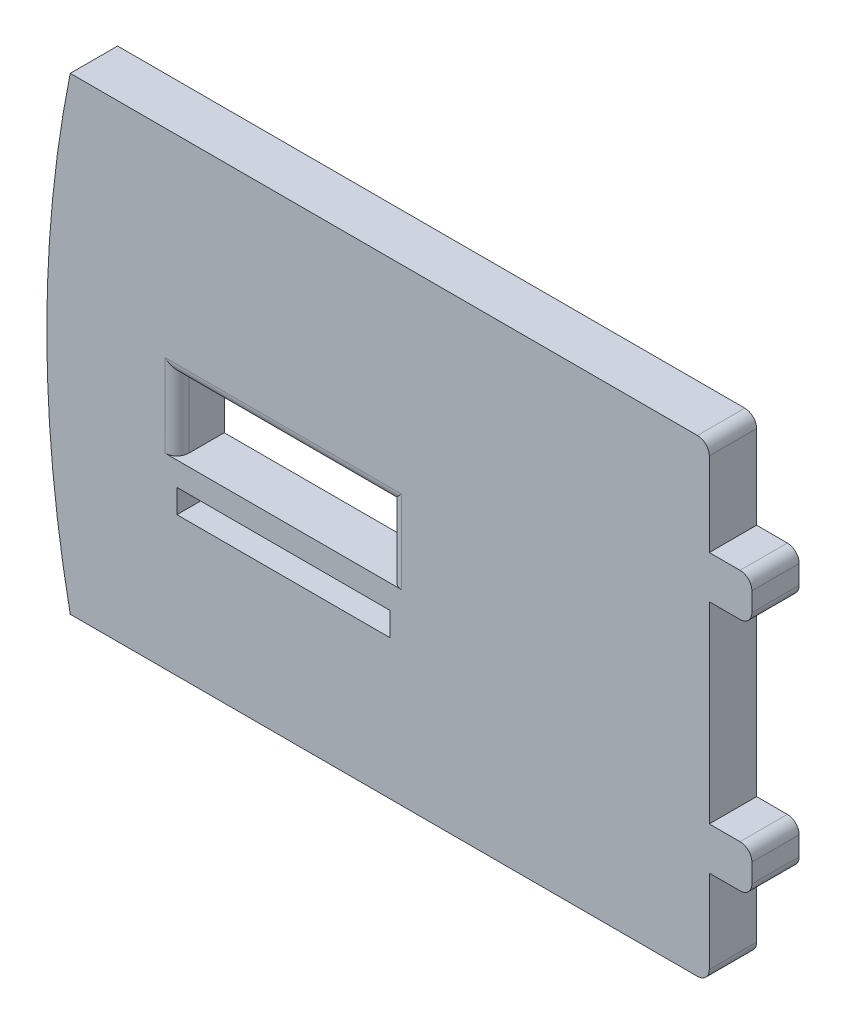
from build123d import *

# Parameters (mm, degrees)
SKETCH1_R           = 50
BOSS_EXTRUDE1_DEPTH = 2
SKETCH1_3_W         = 9
SKETCH1_3_H         = 4
BOSS_EXTRUDE2_DEPTH = 5
CUT_EXTRUDE1_DEPTH  = 9
SKETCH5_W           = 24
SKETCH5_H           = 2
BOSS_EXTRUDE3_DEPTH = 2.5
CUT_EXTRUDE7_DEPTH  = 2
SKETCH8_W           = 33
SKETCH8_H           = 2
BOSS_EXTRUDE4_DEPTH = 2.5
SKETCH13_W          = 24
SKETCH13_H          = 2.5
CUT_EXTRUDE10_DEPTH = 4
SKETCH1_9_R         = 10
CUT_EXTRUDE17_DEPTH = 2
CHAMFER2_SIZE       = 4.5
CHAMFER2_SIZE_2     = 3.150933922
CUT_EXTRUDE19_DEPTH = 9
SKETCH15_W          = 9
SKETCH15_H          = 3
SKETCH15_H_2        = 1
CUT_EXTRUDE20_DEPTH = 2
BOSS_EXTRUDE6_DEPTH = 1.8
FILLET4_R           = 0.5


with BuildPart() as part:
    # Sketch1 → Boss-Extrude1 (new body)
    with BuildSketch(Plane.XY):
        Circle(SKETCH1_R)
    extrude(amount=-BOSS_EXTRUDE1_DEPTH)

    # Sketch1<3> → Boss-Extrude2 (add)
    with BuildSketch(Plane.XY):
        with Locations((-40, 0)):
            Rectangle(SKETCH1_3_W, SKETCH1_3_H)
    extrude(amount=BOSS_EXTRUDE2_DEPTH)

    # Sketch4 → Cut-Extrude1 (cut)
    with BuildSketch(Plane.ZY.offset(44.5)):
        Polygon((0, 0), (2.5, 0), (2.5, -2), (5, -2), (5, 2), (0, 2), align=None)
        Polygon((0, 0), (0, -2), (2.5, 0), align=None)
    extrude(amount=-CUT_EXTRUDE1_DEPTH, mode=Mode.SUBTRACT)


with BuildPart() as cut_extrude1_piece_1:
    # of the separate pieces the step leaves, piece 1, a body of its own (cut_extrude1_pieces)
    add(part.part.solids().sort_by_distance((50, 0, 0))[0])

    # Sketch5 → Boss-Extrude3 (add)
    with BuildSketch(Plane.XY):
        with Locations((-23.5, -1)):
            Rectangle(SKETCH5_W, SKETCH5_H)
    extrude(amount=BOSS_EXTRUDE3_DEPTH)

    # Sketch1<4> → Cut-Extrude7 (cut)
    with BuildSketch(Plane.XY):
        with BuildLine():
            Line((10, 0), (0, 0))
            Line((0, 0), (-10, 0))
            ThreePointArc((-10, 0), (0, -10), (10, 0))
        make_face()
        with BuildLine():
            Line((-10, 0), (0, 0))
            Line((0, 0), (10, 0))
            ThreePointArc((10, 0), (0, 10), (-10, 0))
        make_face()
        with BuildLine():
            Line((10, 0), (0, 0))
            Line((0, 0), (-10, 0))
            ThreePointArc((-10, 0), (0, -10), (10, 0))
        make_face()
        with BuildLine():
            Line((-10, 0), (0, 0))
            Line((0, 0), (10, 0))
            ThreePointArc((10, 0), (0, 10), (-10, 0))
        make_face()
    extrude(amount=-CUT_EXTRUDE7_DEPTH, mode=Mode.SUBTRACT)



with BuildPart() as cut_extrude1_piece_2:
    # of the separate pieces the step leaves, piece 2, a body of its own (cut_extrude1_pieces)
    add(part.part.solids().sort_by_distance((-44.5, -2, 2.5))[0])


with BuildPart() as cut_extrude1_piece_1_1:
    add(cut_extrude1_piece_1.part)

    add(cut_extrude1_piece_2.part)  # Boss-Extrude4 merges Cut-Extrude1 piece 2
    # Sketch8 → Boss-Extrude4 (add)
    with BuildSketch(Plane.XY):
        with Locations((-28, -3)):
            Rectangle(SKETCH8_W, SKETCH8_H)
    extrude(amount=BOSS_EXTRUDE4_DEPTH)

    # Sketch13 → Cut-Extrude10 (cut)
    with BuildSketch(Plane(origin=(0, 0, 0), x_dir=(1, 0, 0), z_dir=(0, 1, 0))):
        with Locations((-23.5, -1.25)):
            Rectangle(SKETCH13_W, SKETCH13_H)
    extrude(amount=-CUT_EXTRUDE10_DEPTH, mode=Mode.SUBTRACT)

    # Sketch1<9> → Cut-Extrude17 (cut)
    with BuildSketch(Plane.XY):
        with BuildLine():
            Line((-22, 9.9), (-22, -9.9))
            Line((-22, -9.9), (-49.010101, -9.9))
            ThreePointArc((-49.010101, -9.9), (50, 0), (-49.010101, 9.9))
            Line((-49.010101, 9.9), (-22, 9.9))
        make_face()
        Circle(SKETCH1_9_R, mode=Mode.SUBTRACT)
    extrude(amount=-CUT_EXTRUDE17_DEPTH, mode=Mode.SUBTRACT)

    # Chamfer2
    # the kernel refuses this chamfer: 4.5, 3.150933922 mm, written as the material it takes off along each edge
    with BuildSketch(Plane(origin=(-35.5, -9.259884147, -9.074855184), x_dir=(-0.9997533347641299, 0.017342841849466925, -0.013874273479573545), z_dir=(0, 0.6246950475544244, 0.7808688094430303))) as chamfer2_piece_1_section:
        Polygon((CHAMFER2_SIZE * 0.999753334764, CHAMFER2_SIZE * 0.0222096741985), (-CHAMFER2_SIZE_2 * 0.0222096741981, CHAMFER2_SIZE_2 * 0.999753334746), (0, 0), align=None)
    chamfer2_piece_1 = extrude(amount=26.444532191, mode=Mode.PRIVATE)
    chamfer2_piece_1 = split(chamfer2_piece_1, bisect_by=Plane(origin=(-37.088065075, -2.140732647, 0), z_dir=(0, 0, 1)), keep=Keep.TOP, mode=Mode.PRIVATE)
    add(chamfer2_piece_1, mode=Mode.SUBTRACT)

    # Sketch17 → Cut-Extrude19 (cut)
    with BuildSketch(Plane.ZY.offset(44.5)):
        Polygon((0, -4), (2.5, -4), (2.5, 0), (0, -2), align=None)
    extrude(amount=-CUT_EXTRUDE19_DEPTH, mode=Mode.SUBTRACT)

    # Sketch15 → Cut-Extrude20 (cut)
    with BuildSketch(Plane(origin=(0, 0, -2), x_dir=(-1, 0, 0), z_dir=(0, 0, -1))):
        with Locations((40, -0.5)):
            Rectangle(SKETCH15_W, SKETCH15_H)
        with Locations((40, -3.5)):
            Rectangle(SKETCH15_W, SKETCH15_H_2)
    extrude(amount=-CUT_EXTRUDE20_DEPTH, mode=Mode.SUBTRACT)

    # Sketch18 → Boss-Extrude6 (add)
    with BuildSketch(Plane(origin=(-22, 0, 0), x_dir=(0, 0, -1), z_dir=(1, 0, 0))):
        Polygon((0, 4.064201772), (2, 4.064201772), (2, 5.864201772), (1, 5.864201772), (0, 5.864201772), align=None)
        Polygon((2, -5.869107155), (2, -4.069107155), (0, -4.069107155), (0, -5.869107155), (1, -5.869107155), align=None)
    extrude(amount=BOSS_EXTRUDE6_DEPTH)

    # Fillet4
    fillet4_edges = [cut_extrude1_piece_1_1.edges().sort_by_distance(p)[0] for p in [
        (-44.5, -0.5, 0),
        (-35.5, -0.5, 0),
        (-40, 1, 0),
        (-20.2, 5.864201772, -1),
        (-20.2, 4.064201772, -1),
        (-20.2, -4.069107155, -1),
        (-20.2, -5.869107155, -1),
        (-22, -9.9, -1),
        (-22, 9.9, -1),
    ]]
    fillet(fillet4_edges, radius=FILLET4_R)


solid = cut_extrude1_piece_1_1.part
